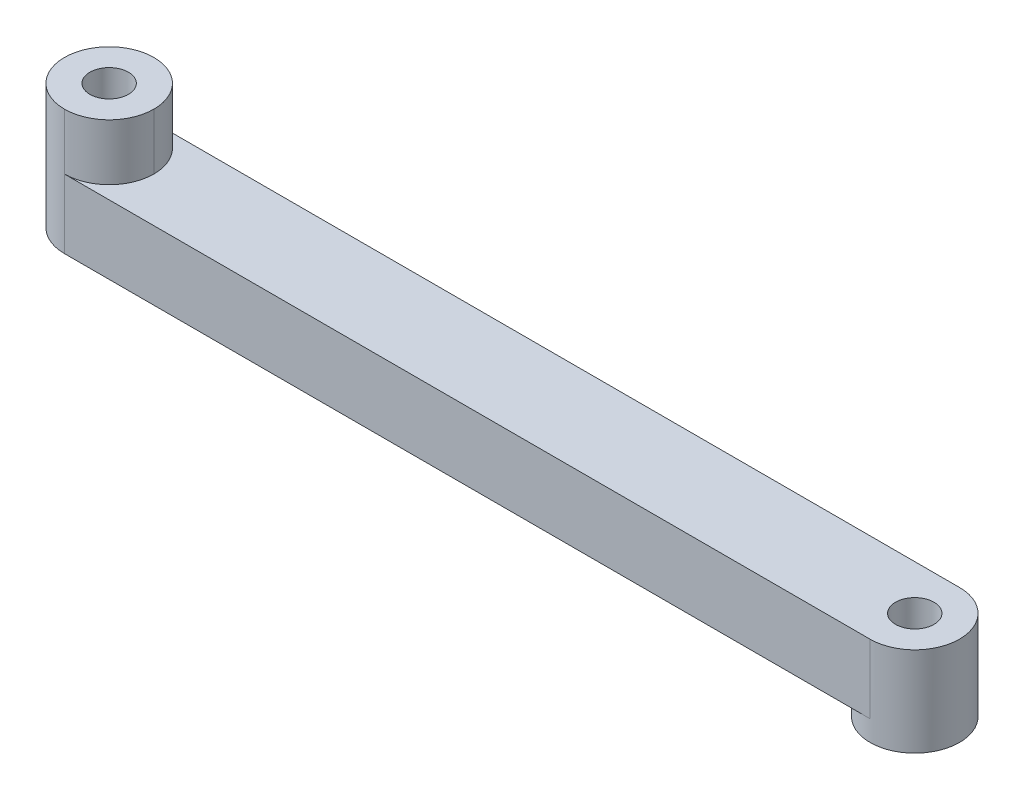
from build123d import *
from build123d.topology import SkipClean

# Parameters (mm, degrees)
SKETCH_1_W          = 100
SKETCH_1_H          = 7.7
EXTRUDE_1_DEPTH     = 10
SKETCH_4_W          = 10
SKETCH_4_H          = 10
EXTRUDE_2_DEPTH     = 6.28
FILLET_1_R          = 5
SKETCH_2_R          = 2.15
CUT_EXTRUDE_1_DEPTH = 53.871924497
SKETCH_5_R          = 5
SKETCH_5_R_2        = 2.15
EXTRUDE_3_DEPTH     = 2.3


with BuildPart() as part:
    # 스케치1 → 보스-돌출1 (new body)
    with BuildSketch(Plane.XY):
        Rectangle(SKETCH_1_W, SKETCH_1_H)
    extrude(amount=EXTRUDE_1_DEPTH)

    # 스케치4 → 보스-돌출2 (add)
    with BuildSketch(Plane(origin=(0, 3.85, 0), x_dir=(1, 0, 0), z_dir=(0, 1, 0))):
        with Locations((-45, -5)):
            Rectangle(SKETCH_4_W, SKETCH_4_H)
    extrude(amount=EXTRUDE_2_DEPTH)

    # 필렛1
    fillet_1_edges = [part.edges().sort_by_distance(p)[0] for p in [
        (50, 0, 0),
        (50, 0, 10),
        (-50, 3.14, 0),
        (-50, 3.14, 10),
        (-40, 6.99, 10),
        (-40, 6.99, 0),
    ]]
    fillet(fillet_1_edges, radius=FILLET_1_R - 0.0001)  # a hair under: the kernel refuses the full size

    # 스케치2 → 컷-돌출1 (cut, through all)
    with BuildSketch(Plane(origin=(0, 10.13, 0), x_dir=(1, 0, 0), z_dir=(0, 1, 0))):
        with Locations(Location((-45, -5, 0), (0, 0, 270))):
            Circle(SKETCH_2_R)
        with Locations(Location((45, -5, 0), (0, 0, 270))):
            Circle(SKETCH_2_R)
    extrude(amount=-CUT_EXTRUDE_1_DEPTH, mode=Mode.SUBTRACT)

    # 스케치5 → 보스-돌출3 (add)
    with SkipClean():  # the faces are left unmerged after this step: merging them gives an invalid solid
        with BuildSketch(Plane.XZ.offset(3.85)):
            with Locations(Location((45, 5, 0), (0, 0, 270))):
                Circle(SKETCH_5_R)
            with Locations(Location((45, 5, 0), (0, 0, 270))):
                Circle(SKETCH_5_R_2, mode=Mode.SUBTRACT)
        extrude(amount=EXTRUDE_3_DEPTH)


solid = part.part
